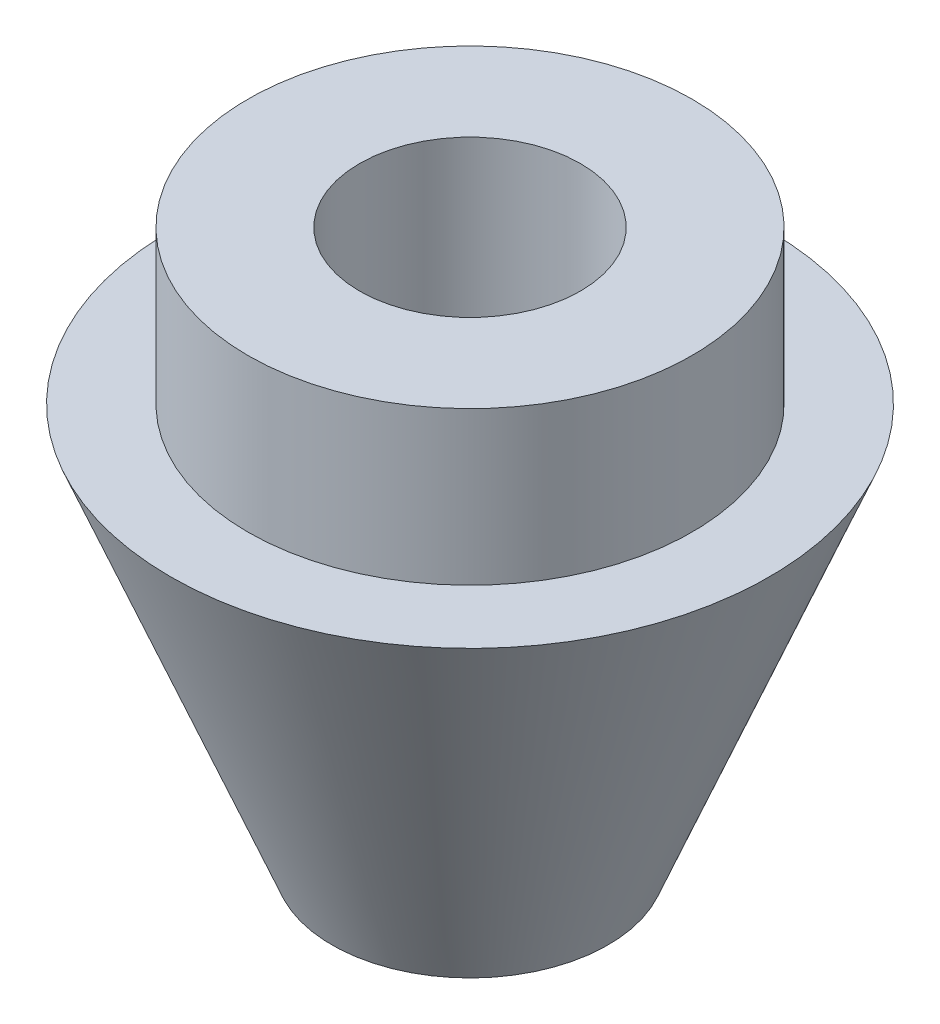
from build123d import *

# Parameters (mm, degrees)
SKETCH_362_R       = 2.54
CUT_EXTRUDE4_DEPTH = 12.7


with BuildPart() as part:
    # Sketch1 → Revolve1 (revolve)
    with BuildSketch(Plane.XY):
        Polygon((0, 0), (0, 12.7), (-5.1054, 12.7), (-5.1054, 9.183788707), (-6.8834, 9.183788707), (-3.175, 0), align=None)
    revolve(axis=Axis((0, 0, 0), (0, 1, 0)))

    # Sketch 362 → Cut-Extrude4 (cut)
    with BuildSketch(Plane(origin=(0, 12.7, 0), x_dir=(1, 0, 0), z_dir=(0, 1, 0))):
        Circle(SKETCH_362_R)
    extrude(amount=-CUT_EXTRUDE4_DEPTH, mode=Mode.SUBTRACT)


solid = part.part
